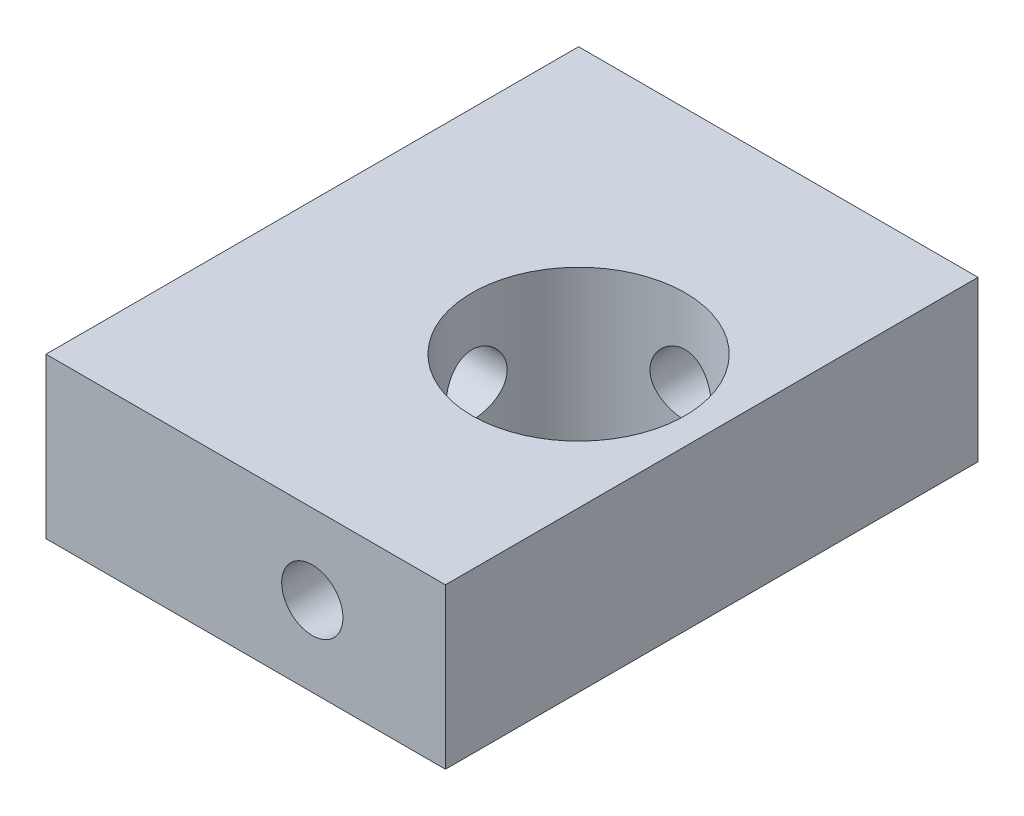
from build123d import *

# Parameters (mm, degrees)
SKETCH1_W           = 15
SKETCH1_H           = 6
SKETCH1_R           = 1.15
BOSS_EXTRUDE1_DEPTH = 20
SKETCH2_R           = 4
CUT_EXTRUDE2_DEPTH  = 20
CUT_EXTRUDE3_REACH  = 27.71
SKETCH4_R           = 1.15


with BuildPart() as part:
    # Sketch1 → Boss-Extrude1 (new body)
    with BuildSketch(Plane.XY):
        with Locations((7.5, 3)):
            Rectangle(SKETCH1_W, SKETCH1_H)
        with Locations((10, 3)):
            Circle(SKETCH1_R, mode=Mode.SUBTRACT)
    extrude(amount=BOSS_EXTRUDE1_DEPTH)

    # Sketch2 → Cut-Extrude2 (cut)
    with BuildSketch(Plane.XZ):
        with Locations((10, 10)):
            Circle(SKETCH2_R)
    extrude(amount=-CUT_EXTRUDE2_DEPTH, mode=Mode.SUBTRACT)

    # Sketch4 → Cut-Extrude3 (cut, up to next)
    with BuildSketch(Plane.ZY, mode=Mode.PRIVATE) as cut_extrude3_sk1:
        with Locations((10, 3)):
            Circle(SKETCH4_R)
    cut_extrude3_tool1 = extrude(cut_extrude3_sk1.sketch, amount=-CUT_EXTRUDE3_REACH, mode=Mode.PRIVATE) & part.part
    add(cut_extrude3_tool1.solids().sort_by_distance((0, 3, 10))[0], mode=Mode.SUBTRACT)


solid = part.part
